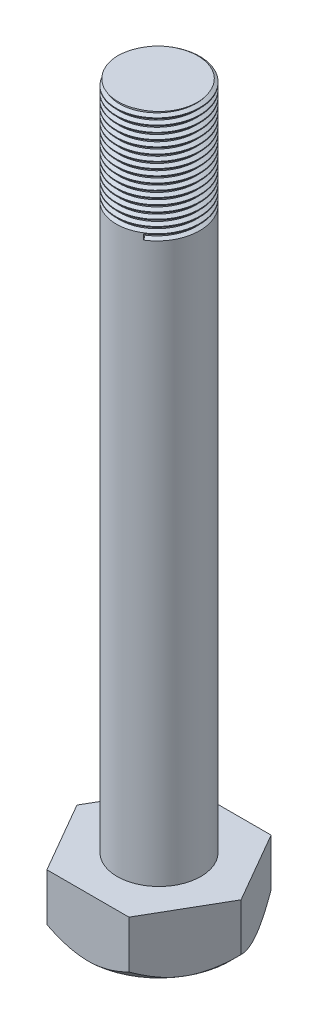
from build123d import *

# Parameters (mm, degrees)
SKETCH1_R           = 10
BOSS_EXTRUDE1_DEPTH = 160
BOSS_EXTRUDE2_DEPTH = 14
SKETCH4_OUTSIDE_W   = 105.578
SKETCH4_OUTSIDE_H   = 100.318
SKETCH4_OUTSIDE_R   = 17
CUT_EXTRUDE1_DEPTH  = 14
CUT_EXTRUDE1_DRAFT  = -45
THREAD1_PITCH       = 1.5


with BuildPart() as part:
    # Sketch1 → Boss-Extrude1 (new body)
    with BuildSketch(Plane(origin=(0, 0, 0), x_dir=(1, 0, 0), z_dir=(0, 1, 0))):
        with Locations(Location((0, 0, 0), (0, 0, 270))):
            Circle(SKETCH1_R)
    extrude(amount=BOSS_EXTRUDE1_DEPTH)

    # Sketch2 → Boss-Extrude2 (add)
    with BuildSketch(Plane.XZ):
        Polygon((19.629909152, 0), (9.814954576, 17), (-9.814954576, 17), (-19.629909152, 0), (-9.814954576, -17), (9.814954576, -17), align=None)
    extrude(amount=BOSS_EXTRUDE2_DEPTH)


with BuildPart() as cut_extrude1_tool:
    # Sketch4 outside → Cut-Extrude1 (with draft: the straight prism first)
    with BuildSketch(Plane.XZ.offset(14)):
        Rectangle(SKETCH4_OUTSIDE_W, SKETCH4_OUTSIDE_H)
        Circle(SKETCH4_OUTSIDE_R, mode=Mode.SUBTRACT)
    extrude(amount=-CUT_EXTRUDE1_DEPTH)
    # Cut-Extrude1: the draft: its side faces are tilted about the plane it starts from
    cut_extrude1_sides = [cut_extrude1_tool.faces().sort_by_distance(p)[0] for p in [
        (0, -7, -50.159),
        (52.789, -7, 0),
        (0, -7, 50.159),
        (-52.789, -7, 0),
        (-17, -7, 0),
    ]]
    draft(cut_extrude1_sides, Plane.XZ.offset(14), CUT_EXTRUDE1_DRAFT)


with BuildPart() as part_1:
    add(part.part)

    # Cut-Extrude1: cut by cut_extrude1_tool
    add(cut_extrude1_tool.part, mode=Mode.SUBTRACT)

    # Thread1: the profile of Thread Profile1 profile screwed along a right-hand helix of 18.666667 turns, 8 arcs to a turn; built about Z, then put on its axis
    thread1_z = Axis((0, 0, 0), (0, 0, 1))
    thread1_corners = [(10.0003, 0, -0.000173205), (10.0003, 0, 1.312673201), (9.188101187, 0, 0.843749998), (9.188101187, 0, 0.468749998)]
    with BuildLine(mode=Mode.PRIVATE) as thread1_profile:
        Line(thread1_corners[0], thread1_corners[1])
        Line(thread1_corners[1], thread1_corners[2])
        Line(thread1_corners[2], thread1_corners[3])
        Line(thread1_corners[3], thread1_corners[0])
    thread1_cap = Face(thread1_profile.wire())
    thread1_turn_angles = [0, 22.5, 45, 67.5, 90, 112.5, 135, 157.5, 180, 202.5, 225, 247.5, 270, 292.5, 315, 337.5, 360]
    thread1_turn_weights = [1, 0.9238795325112867, 1, 0.9238795325112867, 1, 0.9238795325112867, 1, 0.9238795325112867, 1, 0.9238795325112867, 1, 0.9238795325112867, 1, 0.9238795325112867, 1, 0.9238795325112867, 1]
    thread1_turn_rails = [Edge.make_bspline([Vector(p[0], p[1], 0).rotate(thread1_z, thread1_turn_angles[k]) / thread1_turn_weights[k] + Vector(0, 0, p[2] + THREAD1_PITCH * thread1_turn_angles[k] / 360) for k in range(17)], [0, 0, 0, 1, 1, 2, 2, 3, 3, 4, 4, 5, 5, 6, 6, 7, 7, 8, 8, 8], 2, thread1_turn_weights) for p in thread1_corners]
    thread1_turn_sides = [Face.make_surface_from_curves(thread1_turn_rails[p[0]], thread1_turn_rails[p[1]]) for p in [(0, 1), (1, 2), (2, 3), (3, 0)]]
    thread1_last_angles = [6480, 6502.5, 6525, 6547.5, 6570, 6592.5, 6615, 6637.5, 6660, 6682.5, 6705, 6712.5, 6720]
    thread1_last_weights = [1, 0.9238795325112867, 1, 0.9238795325112867, 1, 0.9238795325112867, 1, 0.9238795325112867, 1, 0.9238795325112867, 1, 0.9914448613738115, 1]
    thread1_last_rails = [Edge.make_bspline([Vector(p[0], p[1], 0).rotate(thread1_z, thread1_last_angles[k]) / thread1_last_weights[k] + Vector(0, 0, p[2] + THREAD1_PITCH * thread1_last_angles[k] / 360) for k in range(13)], [0, 0, 0, 1, 1, 2, 2, 3, 3, 4, 4, 5, 5, 6, 6, 6], 2, thread1_last_weights) for p in thread1_corners]
    thread1_last_sides = [Face.make_surface_from_curves(thread1_last_rails[p[0]], thread1_last_rails[p[1]]) for p in [(0, 1), (1, 2), (2, 3), (3, 0)]]
    thread1 = Plane(origin=(0, 163, 0), x_dir=(-1, 0, 0), z_dir=(0, -1, 0)) * Solid(Shell([*[p.moved(Location((0, 0, THREAD1_PITCH * i))) for i in range(18) for p in thread1_turn_sides], *thread1_last_sides, thread1_cap, thread1_cap.rotate(thread1_z, 6720).moved(Location((0, 0, THREAD1_PITCH * 6720 / 360)))]))
    add(thread1, mode=Mode.SUBTRACT)


solid = part_1.part
